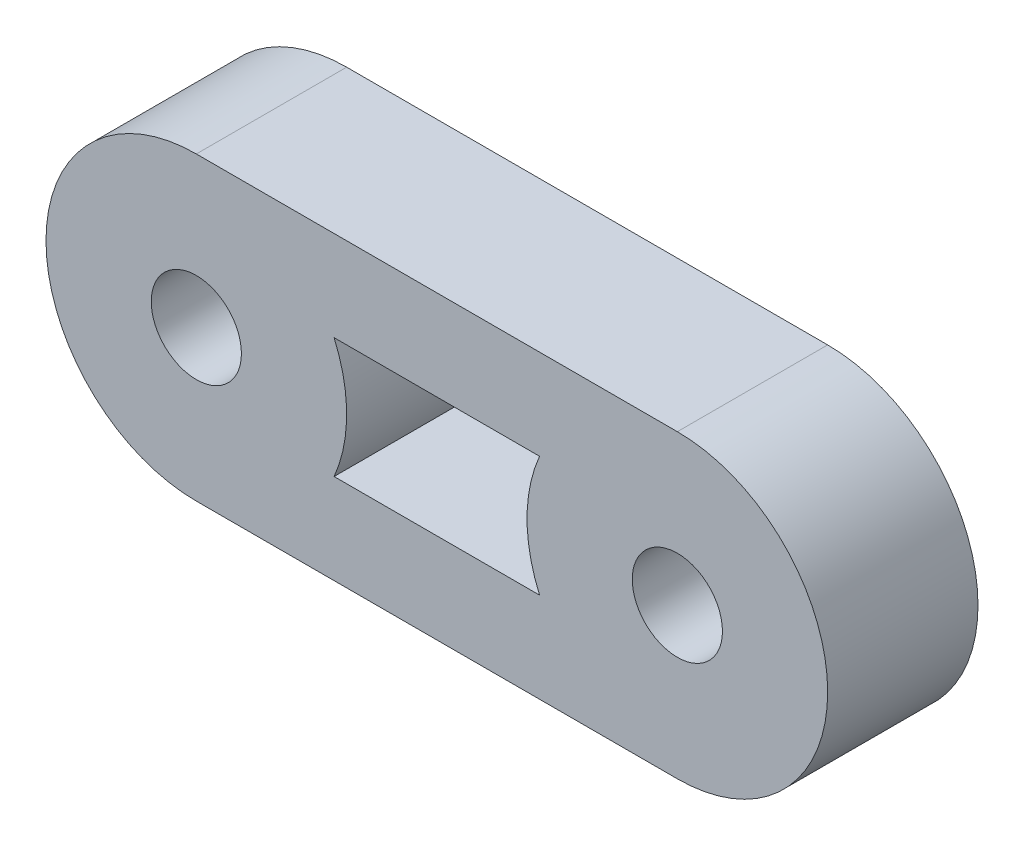
from build123d import *

# Parameters (mm, degrees)
SKETCH1_R          = 1.5
EXTRUDE1_DEPTH     = 5
CUT_EXTRUDE1_START = -10
CUT_EXTRUDE1_DEPTH = 10


with BuildPart() as part:
    # Sketch1 → Extrude1 (new body)
    with BuildSketch(Plane.XY):
        with BuildLine():
            ThreePointArc((0, 5), (-5, 0), (0, -5))
            Line((0, -5), (16, -5))
            ThreePointArc((16, -5), (21, 0), (16, 5))
            Line((16, 5), (0, 5))
        make_face()
        Circle(SKETCH1_R, mode=Mode.SUBTRACT)
        with BuildLine():
            ThreePointArc((17.5, 0), (16, -1.5), (14.5, 0))
            ThreePointArc((14.5, 0), (16, 1.5), (17.5, 0))
        make_face(mode=Mode.SUBTRACT)
    extrude(amount=EXTRUDE1_DEPTH)

    # Sketch2 → Cut-Extrude1 (cut)
    with BuildSketch(Plane.XY.offset(5).offset(CUT_EXTRUDE1_START)):
        with BuildLine():
            Line((4.582575695, -2), (11.417424305, -2))
            ThreePointArc((11.417424305, -2), (11, 0), (11.417424305, 2))
            Line((11.417424305, 2), (4.582575695, 2))
            ThreePointArc((4.582575695, 2), (5, 0), (4.582575695, -2))
        make_face()
    extrude(amount=CUT_EXTRUDE1_DEPTH, mode=Mode.SUBTRACT)


solid = part.part
